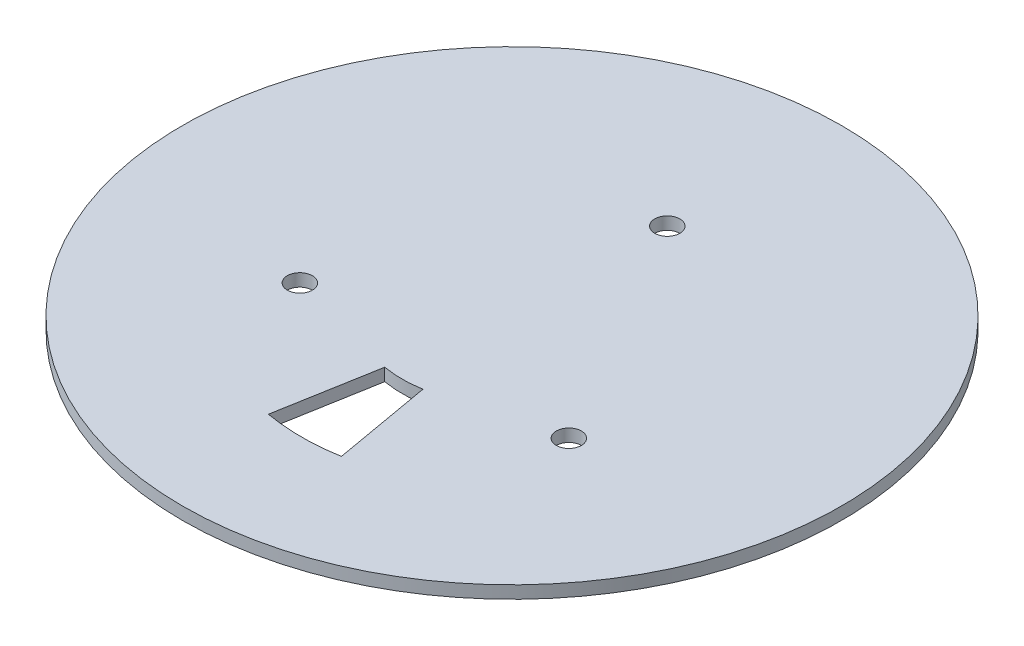
from build123d import *

# Parameters (mm, degrees)
ESBO_O1_R                = 105
RESSALTO_EXTRUS_O1_DEPTH = 4
CORTE_EXTRUS_O1_DEPTH    = 149.546289082
ESBO_O3_R                = 4
CORTE_EXTRUS_O2_DEPTH    = 149.546289082


with BuildPart() as part:
    # Esboço1 → Ressalto-extrusão1 (new body)
    with BuildSketch(Plane(origin=(0, 0, 0), x_dir=(1, 0, 0), z_dir=(0, 1, 0))):
        Circle(ESBO_O1_R)
    extrude(amount=RESSALTO_EXTRUS_O1_DEPTH)

    # Esboço2 → Corte-extrusão1 (cut, through all)
    with BuildSketch(Plane(origin=(0, 4, 0), x_dir=(1, 0, 0), z_dir=(0, 1, 0))):
        with BuildLine():
            Line((-6.077686218, -34.468271355), (-11.634427904, -65.982119452))
            ThreePointArc((-11.634427904, -65.982119452), (0, -67), (11.634427904, -65.982119452))
            Line((11.634427904, -65.982119452), (6.077686218, -34.468271355))
            ThreePointArc((6.077686218, -34.468271355), (0, -35), (-6.077686218, -34.468271355))
        make_face()
    extrude(amount=-CORTE_EXTRUS_O1_DEPTH, mode=Mode.SUBTRACT)

    # Esboço3 → Corte-extrusão2 (cut, through all)
    with BuildSketch(Plane(origin=(0, 4, 0), x_dir=(1, 0, 0), z_dir=(0, 1, 0))):
        with Locations((42.850936979, -24.74)):
            Circle(ESBO_O3_R)
        with Locations((0, 49.48)):
            Circle(ESBO_O3_R)
        with Locations((-42.850936979, -24.74)):
            Circle(ESBO_O3_R)
    extrude(amount=-CORTE_EXTRUS_O2_DEPTH, mode=Mode.SUBTRACT)


solid = part.part
